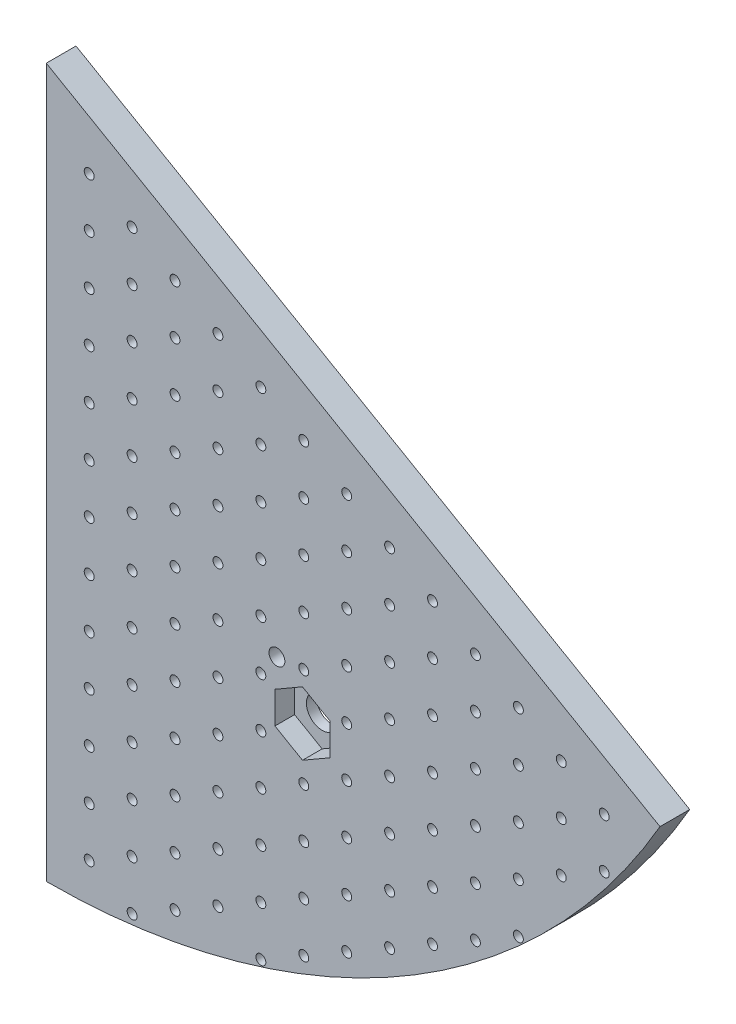
from build123d import *

# Parameters (mm, degrees)
SKETCH1_R               = 143
BOSS_EXTRUDE1_DEPTH     = 6
CUT_REVOLVE_THIN2_DEPTH = 6
SKETCH18_R              = 1.6
CUT_EXTRUDE2_DEPTH      = 10
FILL_PATTERN1_OUTLINE_R = 1
FILL_PATTERN1_DEPTH     = 6
CUT_EXTRUDE3_DEPTH      = 3.96875
SKETCH9_R               = 3.175
CUT_EXTRUDE1_DEPTH      = 10


# Read off the part's stored shape, not the designer's step: Cut-Revolve-Thin2, Fill Pattern1
with BuildPart() as part:
    # Sketch1 → Boss-Extrude1 (new body)
    with BuildSketch(Plane.XY):
        Circle(SKETCH1_R)
    extrude(amount=BOSS_EXTRUDE1_DEPTH)

    # Cut-Revolve-Thin2 outline → Cut-Revolve-Thin2 (cut)
    with BuildSketch(Plane.XY):
        with BuildLine():
            Line((0, -143), (0, 0))
            Line((0, 0), (123.841632741, -71.5))
            ThreePointArc((123.841632741, -71.5), (-71.5, 123.841632741), (0, -143))
        make_face()
    extrude(amount=CUT_REVOLVE_THIN2_DEPTH, mode=Mode.SUBTRACT)

    # Sketch18 → Cut-Extrude2 (cut)
    with BuildSketch(Plane.XY.offset(6)):
        with Locations((46.541650131, -80.499989045)):
            Circle(SKETCH18_R)
    extrude(amount=-CUT_EXTRUDE2_DEPTH, mode=Mode.SUBTRACT)

    # Fill Pattern1 outline → Fill Pattern1 (cut)
    with BuildSketch(Plane.XY):
        with Locations((34.641016151, -110)):
            Circle(FILL_PATTERN1_OUTLINE_R)
        with Locations((34.641016151, -100)):
            Circle(FILL_PATTERN1_OUTLINE_R)
        with Locations((34.641016151, -90)):
            Circle(FILL_PATTERN1_OUTLINE_R)
        with Locations((34.641016151, -80)):
            Circle(FILL_PATTERN1_OUTLINE_R)
        with Locations((34.641016151, -70)):
            Circle(FILL_PATTERN1_OUTLINE_R)
        with Locations((34.641016151, -60)):
            Circle(FILL_PATTERN1_OUTLINE_R)
        with Locations((34.641016151, -50)):
            Circle(FILL_PATTERN1_OUTLINE_R)
        with Locations((34.641016151, -40)):
            Circle(FILL_PATTERN1_OUTLINE_R)
        with Locations((25.980762114, -85)):
            Circle(FILL_PATTERN1_OUTLINE_R)
        with Locations((25.980762114, -95)):
            Circle(FILL_PATTERN1_OUTLINE_R)
        with Locations((25.980762114, -105)):
            Circle(FILL_PATTERN1_OUTLINE_R)
        with Locations((25.980762114, -115)):
            Circle(FILL_PATTERN1_OUTLINE_R)
        with Locations((34.641016151, -30)):
            Circle(FILL_PATTERN1_OUTLINE_R)
        with Locations((25.980762114, -135)):
            Circle(FILL_PATTERN1_OUTLINE_R)
        with Locations((25.980762114, -125)):
            Circle(FILL_PATTERN1_OUTLINE_R)
        with Locations((43.301270189, -85)):
            Circle(FILL_PATTERN1_OUTLINE_R)
        with Locations((43.301270189, -95)):
            Circle(FILL_PATTERN1_OUTLINE_R)
        with Locations((43.301270189, -105)):
            Circle(FILL_PATTERN1_OUTLINE_R)
        with Locations((43.301270189, -115)):
            Circle(FILL_PATTERN1_OUTLINE_R)
        with Locations((43.301270189, -125)):
            Circle(FILL_PATTERN1_OUTLINE_R)
        with Locations((43.301270189, -135)):
            Circle(FILL_PATTERN1_OUTLINE_R)
        with Locations((51.961524227, -40)):
            Circle(FILL_PATTERN1_OUTLINE_R)
        with Locations((51.961524227, -50)):
            Circle(FILL_PATTERN1_OUTLINE_R)
        with Locations((43.301270189, -35)):
            Circle(FILL_PATTERN1_OUTLINE_R)
        with Locations((34.641016151, -130)):
            Circle(FILL_PATTERN1_OUTLINE_R)
        with Locations((34.641016151, -120)):
            Circle(FILL_PATTERN1_OUTLINE_R)
        with Locations((43.301270189, -45)):
            Circle(FILL_PATTERN1_OUTLINE_R)
        with Locations((43.301270189, -55)):
            Circle(FILL_PATTERN1_OUTLINE_R)
        with Locations((43.301270189, -65)):
            Circle(FILL_PATTERN1_OUTLINE_R)
        with Locations((43.301270189, -75)):
            Circle(FILL_PATTERN1_OUTLINE_R)
        with Locations((8.660254038, -105)):
            Circle(FILL_PATTERN1_OUTLINE_R)
        with Locations((8.660254038, -115)):
            Circle(FILL_PATTERN1_OUTLINE_R)
        with Locations((8.660254038, -125)):
            Circle(FILL_PATTERN1_OUTLINE_R)
        with Locations((8.660254038, -135)):
            Circle(FILL_PATTERN1_OUTLINE_R)
        with Locations((17.320508076, -40)):
            Circle(FILL_PATTERN1_OUTLINE_R)
        with Locations((17.320508076, -30)):
            Circle(FILL_PATTERN1_OUTLINE_R)
        with Locations((17.320508076, -20)):
            Circle(FILL_PATTERN1_OUTLINE_R)
        with Locations((8.660254038, -95)):
            Circle(FILL_PATTERN1_OUTLINE_R)
        with Locations((8.660254038, -85)):
            Circle(FILL_PATTERN1_OUTLINE_R)
        with Locations((8.660254038, -75)):
            Circle(FILL_PATTERN1_OUTLINE_R)
        with Locations((8.660254038, -65)):
            Circle(FILL_PATTERN1_OUTLINE_R)
        with Locations((8.660254038, -55)):
            Circle(FILL_PATTERN1_OUTLINE_R)
        with Locations((8.660254038, -45)):
            Circle(FILL_PATTERN1_OUTLINE_R)
        with Locations((8.660254038, -35)):
            Circle(FILL_PATTERN1_OUTLINE_R)
        with Locations((8.660254038, -25)):
            Circle(FILL_PATTERN1_OUTLINE_R)
        with Locations((17.320508076, -130)):
            Circle(FILL_PATTERN1_OUTLINE_R)
        with Locations((17.320508076, -140)):
            Circle(FILL_PATTERN1_OUTLINE_R)
        with Locations((25.980762114, -25)):
            Circle(FILL_PATTERN1_OUTLINE_R)
        with Locations((25.980762114, -35)):
            Circle(FILL_PATTERN1_OUTLINE_R)
        with Locations((25.980762114, -45)):
            Circle(FILL_PATTERN1_OUTLINE_R)
        with Locations((25.980762114, -55)):
            Circle(FILL_PATTERN1_OUTLINE_R)
        with Locations((25.980762114, -65)):
            Circle(FILL_PATTERN1_OUTLINE_R)
        with Locations((25.980762114, -75)):
            Circle(FILL_PATTERN1_OUTLINE_R)
        with Locations((17.320508076, -120)):
            Circle(FILL_PATTERN1_OUTLINE_R)
        with Locations((17.320508076, -110)):
            Circle(FILL_PATTERN1_OUTLINE_R)
        with Locations((17.320508076, -100)):
            Circle(FILL_PATTERN1_OUTLINE_R)
        with Locations((17.320508076, -90)):
            Circle(FILL_PATTERN1_OUTLINE_R)
        with Locations((17.320508076, -80)):
            Circle(FILL_PATTERN1_OUTLINE_R)
        with Locations((17.320508076, -70)):
            Circle(FILL_PATTERN1_OUTLINE_R)
        with Locations((17.320508076, -60)):
            Circle(FILL_PATTERN1_OUTLINE_R)
        with Locations((17.320508076, -50)):
            Circle(FILL_PATTERN1_OUTLINE_R)
        with Locations((95.262794416, -65)):
            Circle(FILL_PATTERN1_OUTLINE_R)
        with Locations((86.602540378, -110)):
            Circle(FILL_PATTERN1_OUTLINE_R)
        with Locations((86.602540378, -100)):
            Circle(FILL_PATTERN1_OUTLINE_R)
        with Locations((95.262794416, -75)):
            Circle(FILL_PATTERN1_OUTLINE_R)
        with Locations((95.262794416, -85)):
            Circle(FILL_PATTERN1_OUTLINE_R)
        with Locations((95.262794416, -95)):
            Circle(FILL_PATTERN1_OUTLINE_R)
        with Locations((95.262794416, -105)):
            Circle(FILL_PATTERN1_OUTLINE_R)
        with Locations((86.602540378, -90)):
            Circle(FILL_PATTERN1_OUTLINE_R)
        with Locations((86.602540378, -80)):
            Circle(FILL_PATTERN1_OUTLINE_R)
        with Locations((86.602540378, -70)):
            Circle(FILL_PATTERN1_OUTLINE_R)
        with Locations((86.602540378, -60)):
            Circle(FILL_PATTERN1_OUTLINE_R)
        with Locations((77.942286341, -115)):
            Circle(FILL_PATTERN1_OUTLINE_R)
        with Locations((77.942286341, -105)):
            Circle(FILL_PATTERN1_OUTLINE_R)
        with Locations((77.942286341, -95)):
            Circle(FILL_PATTERN1_OUTLINE_R)
        with Locations((112.583302492, -75)):
            Circle(FILL_PATTERN1_OUTLINE_R)
        with Locations((112.583302492, -85)):
            Circle(FILL_PATTERN1_OUTLINE_R)
        with Locations((103.923048454, -70)):
            Circle(FILL_PATTERN1_OUTLINE_R)
        with Locations((103.923048454, -80)):
            Circle(FILL_PATTERN1_OUTLINE_R)
        with Locations((103.923048454, -90)):
            Circle(FILL_PATTERN1_OUTLINE_R)
        with Locations((60.621778265, -65)):
            Circle(FILL_PATTERN1_OUTLINE_R)
        with Locations((60.621778265, -55)):
            Circle(FILL_PATTERN1_OUTLINE_R)
        with Locations((60.621778265, -45)):
            Circle(FILL_PATTERN1_OUTLINE_R)
        with Locations((60.621778265, -75)):
            Circle(FILL_PATTERN1_OUTLINE_R)
        with Locations((60.621778265, -85)):
            Circle(FILL_PATTERN1_OUTLINE_R)
        with Locations((60.621778265, -95)):
            Circle(FILL_PATTERN1_OUTLINE_R)
        with Locations((60.621778265, -105)):
            Circle(FILL_PATTERN1_OUTLINE_R)
        with Locations((51.961524227, -130)):
            Circle(FILL_PATTERN1_OUTLINE_R)
        with Locations((51.961524227, -120)):
            Circle(FILL_PATTERN1_OUTLINE_R)
        with Locations((51.961524227, -110)):
            Circle(FILL_PATTERN1_OUTLINE_R)
        with Locations((51.961524227, -100)):
            Circle(FILL_PATTERN1_OUTLINE_R)
        with Locations((51.961524227, -90)):
            Circle(FILL_PATTERN1_OUTLINE_R)
        with Locations((51.961524227, -80)):
            Circle(FILL_PATTERN1_OUTLINE_R)
        with Locations((51.961524227, -70)):
            Circle(FILL_PATTERN1_OUTLINE_R)
        with Locations((51.961524227, -60)):
            Circle(FILL_PATTERN1_OUTLINE_R)
        with Locations((77.942286341, -85)):
            Circle(FILL_PATTERN1_OUTLINE_R)
        with Locations((77.942286341, -75)):
            Circle(FILL_PATTERN1_OUTLINE_R)
        with Locations((77.942286341, -65)):
            Circle(FILL_PATTERN1_OUTLINE_R)
        with Locations((77.942286341, -55)):
            Circle(FILL_PATTERN1_OUTLINE_R)
        with Locations((69.282032303, -120)):
            Circle(FILL_PATTERN1_OUTLINE_R)
        with Locations((69.282032303, -110)):
            Circle(FILL_PATTERN1_OUTLINE_R)
        with Locations((69.282032303, -100)):
            Circle(FILL_PATTERN1_OUTLINE_R)
        with Locations((69.282032303, -50)):
            Circle(FILL_PATTERN1_OUTLINE_R)
        with Locations((60.621778265, -125)):
            Circle(FILL_PATTERN1_OUTLINE_R)
        with Locations((60.621778265, -115)):
            Circle(FILL_PATTERN1_OUTLINE_R)
        with Locations((69.282032303, -60)):
            Circle(FILL_PATTERN1_OUTLINE_R)
        with Locations((69.282032303, -70)):
            Circle(FILL_PATTERN1_OUTLINE_R)
        with Locations((69.282032303, -80)):
            Circle(FILL_PATTERN1_OUTLINE_R)
        with Locations((69.282032303, -90)):
            Circle(FILL_PATTERN1_OUTLINE_R)
        with Locations((8.660254038, -15)):
            Circle(FILL_PATTERN1_OUTLINE_R)
    extrude(amount=FILL_PATTERN1_DEPTH, mode=Mode.SUBTRACT)

    # Sketch19 → Cut-Extrude3 (cut)
    with BuildSketch(Plane.XY.offset(6)):
        Polygon((46.143210109, -92.760486747), (51.699460109, -95.968389181), (57.255710109, -92.760486747), (57.255710109, -86.344681881), (51.699460109, -83.136779448), (46.143210109, -86.344681881), align=None)
    extrude(amount=-CUT_EXTRUDE3_DEPTH, mode=Mode.SUBTRACT)

    # Sketch9 → Cut-Extrude1 (cut)
    with BuildSketch(Plane.XY.offset(6)):
        with Locations((51.699460109, -89.552584314)):
            Circle(SKETCH9_R)
    extrude(amount=-CUT_EXTRUDE1_DEPTH, mode=Mode.SUBTRACT)


solid = part.part
